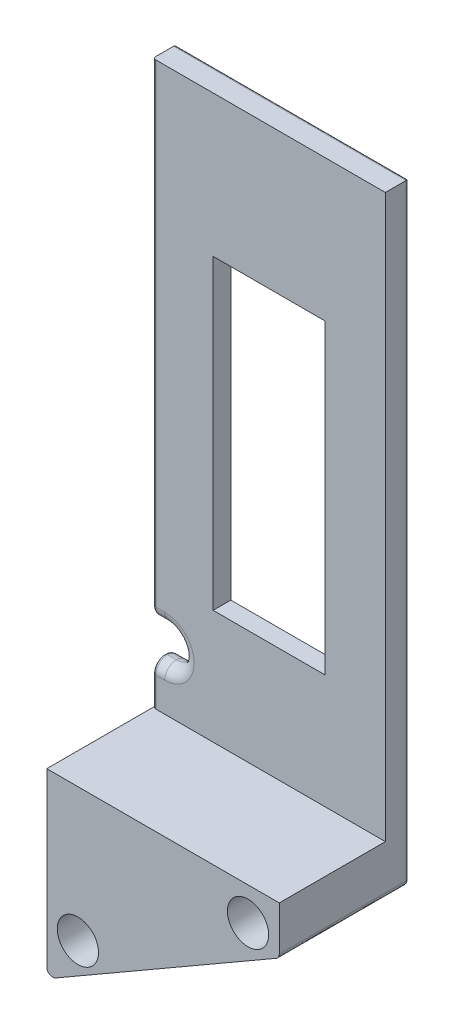
from build123d import *

# Parameters (mm, degrees)
SKETCH4_R               = 1.2500000000000113
SKETCH4_R_2             = 1.2499999999999978
BOSS_EXTRUDE4_DEPTH     = 2
SKETCH4_5_R             = 1.7500000000000104
SKETCH4_5_R_2           = 1.749999999999997
BOSS_EXTRUDE5_DEPTH     = 9
SKETCH4_6_R             = 1.749999999999997
SKETCH4_6_R_2           = 1.2499999999999978
SKETCH4_6_R_3           = 1.7500000000000104
SKETCH4_6_R_4           = 1.2500000000000113
BOSS_EXTRUDE6_DEPTH     = 3
CUT_EXTRUDE1_DEPTH      = 158.79099158717955
CUT_EXTRUDE1_DEPTH_BACK = 158.79099158717955
FILLET1_R               = 1
FILLET2_R               = 0.25
CUT_EXTRUDE2_DEPTH      = 158.79099158717955
CUT_EXTRUDE2_DEPTH_BACK = 158.79099158717955
CHAMFER1_SIZE           = 0.5


with BuildPart() as part:
    # Sketch4 → Boss-Extrude4 (new body)
    with BuildSketch(Plane.XY):
        with BuildLine():
            add(Edge.make_bspline(
                [(-121.0977219670568, -59.96744638283075), (-120.94298009720131, -59.87814106550356), (-120.8476486211035, -59.71305439455445), (-120.8476486210958, -59.53439134300407)],
                knots=[3, 3, 3, 3, 4, 4, 4, 4], degree=3))
            Line((-120.8476486210958, -59.53439134300407), (-120.8476486189429, -11.586453102615721))
            Line((-120.8476486189429, -11.58645310261572), (-120.8476486189429, -8.0865191630969))
            Line((-120.8476486189429, -8.0865191630969), (-140.5664979509455, -8.083912687906277))
            Line((-140.5664979509455, -8.083912687906277), (-140.5664979509455, -11.58397880929067))
            Line((-140.5664979509455, -11.58397880929067), (-140.5664979535839, -70.33749706476789))
            add(Edge.make_bspline(
                [(-140.5664979535839, -70.33749706476789), (-140.5664979536002, -70.72235960570497), (-140.1499046258814, -70.96292691883274), (-139.8165712997942, -70.7705521046382)],
                knots=[1, 1, 1, 1, 2, 2, 2, 2], degree=3))
            Line((-139.8165712997942, -70.7705521046382), (-121.0977219670568, -59.96744638283075))
        make_face()
        with Locations((-137.92794657478115, -67.08936245467149)):
            Circle(SKETCH4_R, mode=Mode.SUBTRACT)
        with Locations((-123.49593879557014, -58.568434854590414)):
            Circle(SKETCH4_R_2, mode=Mode.SUBTRACT)
    extrude(amount=-BOSS_EXTRUDE4_DEPTH)

    # Sketch4<5> → Boss-Extrude5 (add)
    # profile 1 of 2: a face of its own
    with BuildSketch(Plane.XY):
        Polygon((-140.56649795336358, -65.4304148764118), (-123.8285782795111, -55.7705521046382), (-140.56649795292978, -55.7705521046382), align=None)
    # profile 2 of 2: a face of its own
    with BuildSketch(Plane.XY):
        with BuildLine():
            add(Edge.make_bspline(
                [(-121.0977219670568, -59.96744638283075), (-120.94298009720131, -59.87814106550356), (-120.8476486211035, -59.71305439455445), (-120.8476486210958, -59.53439134300407)],
                knots=[3, 3, 3, 3, 4, 4, 4, 4], degree=3))
            Line((-120.8476486210958, -59.53439134300407), (-120.8476486209268, -55.7705521046382))
            Line((-120.84764862092679, -55.7705521046382), (-123.8285782795111, -55.7705521046382))
            Line((-123.8285782795111, -55.7705521046382), (-140.56649795336358, -65.4304148764118))
            Line((-140.56649795336355, -65.4304148764118), (-140.5664979535839, -70.33749706476789))
            add(Edge.make_bspline(
                [(-140.5664979535839, -70.33749706476789), (-140.5664979536002, -70.72235960570497), (-140.1499046258814, -70.96292691883274), (-139.8165712997942, -70.7705521046382)],
                knots=[1, 1, 1, 1, 2, 2, 2, 2], degree=3))
            Line((-139.8165712997942, -70.7705521046382), (-121.0977219670568, -59.96744638283075))
        make_face()
        with Locations((-137.92794657478115, -67.08936245467149)):
            Circle(SKETCH4_5_R, mode=Mode.SUBTRACT)
        with Locations((-123.49593879557014, -58.568434854590414)):
            Circle(SKETCH4_5_R_2, mode=Mode.SUBTRACT)
    extrude(amount=BOSS_EXTRUDE5_DEPTH)

    # Sketch4<6> → Boss-Extrude6 (add)
    # profile 1 of 2: a face of its own
    with BuildSketch(Plane.XY):
        with Locations((-123.49593879557014, -58.568434854590414)):
            Circle(SKETCH4_6_R)
        with Locations((-123.49593879557014, -58.568434854590414)):
            Circle(SKETCH4_6_R_2, mode=Mode.SUBTRACT)
    # profile 2 of 2: a face of its own
    with BuildSketch(Plane.XY):
        with Locations((-137.92794657478115, -67.08936245467149)):
            Circle(SKETCH4_6_R_3)
        with Locations((-137.92794657478115, -67.08936245467149)):
            Circle(SKETCH4_6_R_4, mode=Mode.SUBTRACT)
    extrude(amount=BOSS_EXTRUDE6_DEPTH)

    # Sketch8 → Cut-Extrude1 (cut, two sides: drawn at the far end of the back side and taken through both)
    with BuildSketch(Plane(origin=(0, 0, -2), x_dir=(-1, 0, 0), z_dir=(0, 0, -1)).offset(-CUT_EXTRUDE1_DEPTH_BACK)):
        with BuildLine():
            Line((139.5664979509455, -49.27055210463822), (143.2884320777397, -49.27055210463822))
            Line((143.2884320777397, -49.27055210463822), (143.2884320777397, -52.270552104638206))
            Line((143.2884320777397, -52.270552104638206), (139.5664979509455, -52.270552104638206))
            ThreePointArc((139.5664979509455, -52.270552104638206), (138.0664979509455, -50.77055210463821), (139.5664979509455, -49.27055210463822))
        make_face()
    extrude(amount=CUT_EXTRUDE1_DEPTH + CUT_EXTRUDE1_DEPTH_BACK, mode=Mode.SUBTRACT)

    # Fillet1
    fillet1_edges = [part.edges().sort_by_distance(p)[0] for p in [
        (-140.06649795193763, -52.270552104638206, 0),
        (-140.06649795227284, -52.270552104638206, -2),
        (-140.06649795193763, -49.27055210463822, 0),
        (-140.06649795227284, -49.27055210463822, -2),
        (-138.0664979509455, -50.77055210463821, 0),
        (-138.0664979509455, -50.77055210463821, -2),
    ]]
    fillet(fillet1_edges, radius=FILLET1_R - 0.0001)  # a hair under: the kernel refuses the full size

    # Fillet2
    fillet2_edges = [part.edges().sort_by_distance(p)[0] for p in [
        (-140.56649795176924, -29.927315456964447, 0),
        (-140.31653462082718, -70.7704885946968, -2),
        (-130.4571466334255, -65.36899924373448, -2),
        (-120.91465709288339, -59.78442801325112, -2),
        (-120.84764862001936, -35.56042222280989, -2),
        (-130.7070732849442, -8.08521592550159, -2),
        (-124.74593879557014, -58.568434854590414, -2),
        (-139.17794657478115, -67.08936245467149, -2),
        (-140.56649795176924, -29.927315456964447, -2),
        (-140.56649795287362, -54.5205021046382, 0),
        (-140.5664979532007, -61.80397458470304, -2),
        (-140.56649795281749, -52.56341603412977, -1.707136070508429),
        (-140.56649795281749, -52.56341603412977, -0.29286392949157103),
        (-140.56649795259295, -48.97768817514665, -1.707136070508429),
        (-140.56649795259295, -48.97768817514665, -0.2928639294915709),
    ]]
    fillet(fillet2_edges, radius=FILLET2_R)

    # Sketch9 → Cut-Extrude2 (cut, two sides: drawn at the far end of the back side and taken through both)
    with BuildSketch(Plane(origin=(0, 0, -2), x_dir=(-1, 0, 0), z_dir=(0, 0, -1)).offset(-CUT_EXTRUDE2_DEPTH_BACK)):
        Polygon((125.95707332644032, -20.085843894406473), (135.45707324344806, -20.084588166261394), (135.45707324344806, -46.08458816626139), (125.95707332644032, -46.08458816626139), align=None)
    extrude(amount=CUT_EXTRUDE2_DEPTH + CUT_EXTRUDE2_DEPTH_BACK, mode=Mode.SUBTRACT)

    # Chamfer1
    chamfer1_edges = [part.edges().sort_by_distance(p)[0] for p in [
        (-125.95707332644032, -33.08521603033393, -2),
        (-130.7070732849442, -20.08521603033393, -2),
        (-135.45707324344806, -33.08458816626139, -2),
        (-130.7070732849442, -46.08458816626139, -2),
    ]]
    chamfer(chamfer1_edges, length=CHAMFER1_SIZE)


solid = part.part
